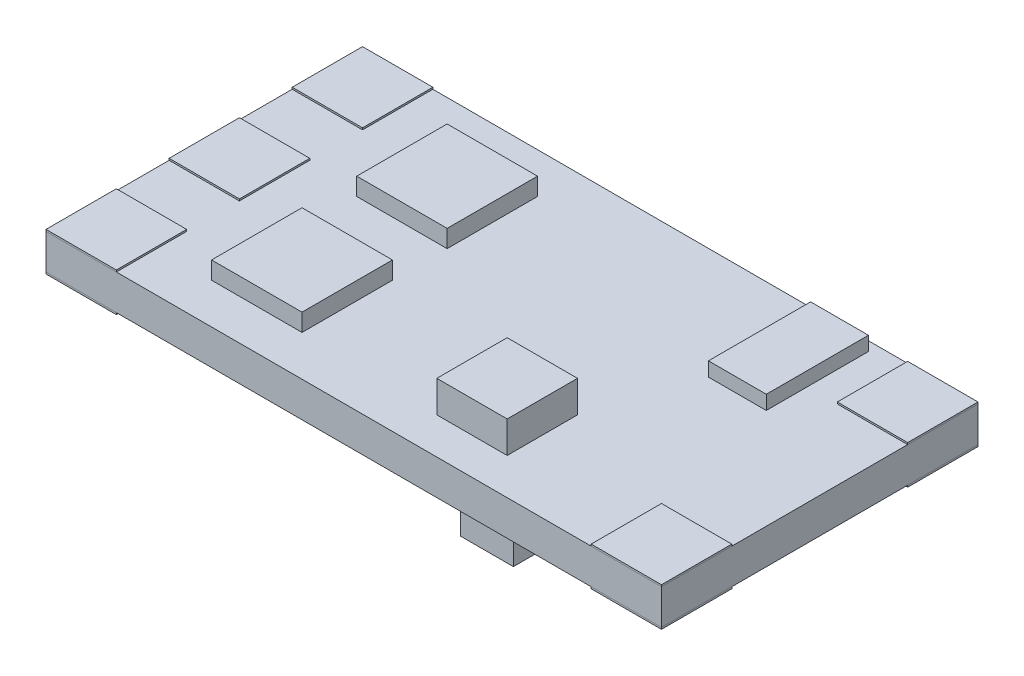
from build123d import *

# Parameters (mm, degrees)
SKETCH1_W             = 35
SKETCH1_H             = 18
BOSS_EXTRUDE1_DEPTH   = 2
SKETCH2_W             = 3.290634233
SKETCH2_H             = 5.810026068
BOSS_EXTRUDE2_DEPTH   = 0.8
SKETCH3_W             = 4
SKETCH3_H             = 4
BOSS_EXTRUDE3_DEPTH   = 1.8
SKETCH4_W             = 5.141615989
SKETCH4_H             = 5.141615989
BOSS_EXTRUDE4_DEPTH   = 1
BOSS_EXTRUDE4_2_DEPTH = 1
SKETCH5_W             = 4
SKETCH5_H             = 4
BOSS_EXTRUDE5_DEPTH   = 0.1
BOSS_EXTRUDE5_2_DEPTH = 0.1
BOSS_EXTRUDE5_3_DEPTH = 0.1
BOSS_EXTRUDE5_4_DEPTH = 0.1
BOSS_EXTRUDE5_5_DEPTH = 0.1
SKETCH6_W             = 6.694846846
SKETCH6_H             = 4.476078856
BOSS_EXTRUDE6_DEPTH   = 0.7
BOSS_EXTRUDE6_2_DEPTH = 0.7
BOSS_EXTRUDE6_3_DEPTH = 0.7
BOSS_EXTRUDE6_4_DEPTH = 0.7
BOSS_EXTRUDE6_5_DEPTH = 0.7
BOSS_EXTRUDE6_6_DEPTH = 0.7
SKETCH7_W             = 3
SKETCH7_H             = 1.6
BOSS_EXTRUDE7_DEPTH   = 1.8
BOSS_EXTRUDE7_2_DEPTH = 1.8
BOSS_EXTRUDE7_3_DEPTH = 1.8
BOSS_EXTRUDE7_4_DEPTH = 1.8
BOSS_EXTRUDE7_5_DEPTH = 1.8
BOSS_EXTRUDE7_6_DEPTH = 1.8
BOSS_EXTRUDE7_7_DEPTH = 1.8
BOSS_EXTRUDE7_8_DEPTH = 1.8


with BuildPart() as part:
    # Sketch1 → Boss-Extrude1 (new body)
    with BuildSketch(Plane(origin=(0, 0, 0), x_dir=(1, 0, 0), z_dir=(0, 1, 0))):
        Rectangle(SKETCH1_W, SKETCH1_H)
    extrude(amount=BOSS_EXTRUDE1_DEPTH)


with BuildPart() as body_2:
    # Sketch2 → Boss-Extrude2 (new body)
    with BuildSketch(Plane(origin=(0, 2, 0), x_dir=(1, 0, 0), z_dir=(0, 1, 0))):
        with Locations((10.154691578, 5.565799308)):
            Rectangle(SKETCH2_W, SKETCH2_H)
    extrude(amount=BOSS_EXTRUDE2_DEPTH)


with BuildPart() as body_3:
    # Sketch3 → Boss-Extrude3 (new body)
    with BuildSketch(Plane(origin=(0, 2, 0), x_dir=(1, 0, 0), z_dir=(0, 1, 0))):
        with Locations((4.647932234, -4.923097309)):
            Rectangle(SKETCH3_W, SKETCH3_H)
    extrude(amount=BOSS_EXTRUDE3_DEPTH)


with BuildPart() as body_4:
    # Sketch4 → Boss-Extrude4 (new body)
    with BuildSketch(Plane(origin=(0, 2, 0), x_dir=(1, 0, 0), z_dir=(0, 1, 0))):
        with Locations((-7.815256304, -4.126146832)):
            Rectangle(SKETCH4_W, SKETCH4_H)
    extrude(amount=BOSS_EXTRUDE4_DEPTH)


with BuildPart() as body_5:
    # Sketch4 → Boss-Extrude4 2 (new body)
    with BuildSketch(Plane(origin=(0, 2, 0), x_dir=(1, 0, 0), z_dir=(0, 1, 0))):
        with Locations((-7.815256304, 4.126146832)):
            Rectangle(SKETCH4_W, SKETCH4_H)
    extrude(amount=BOSS_EXTRUDE4_2_DEPTH)


with BuildPart() as body_6:
    # Sketch5 → Boss-Extrude5 (new body)
    with BuildSketch(Plane(origin=(0, 2, 0), x_dir=(1, 0, 0), z_dir=(0, 1, 0))):
        with Locations((-15.5, 7)):
            Rectangle(SKETCH5_W, SKETCH5_H)
    extrude(amount=BOSS_EXTRUDE5_DEPTH)


with BuildPart() as body_7:
    # Sketch5 → Boss-Extrude5 2 (new body)
    with BuildSketch(Plane(origin=(0, 2, 0), x_dir=(1, 0, 0), z_dir=(0, 1, 0))):
        with Locations((-15.5, 0)):
            Rectangle(SKETCH5_W, SKETCH5_H)
    extrude(amount=BOSS_EXTRUDE5_2_DEPTH)


with BuildPart() as body_8:
    # Sketch5 → Boss-Extrude5 3 (new body)
    with BuildSketch(Plane(origin=(0, 2, 0), x_dir=(1, 0, 0), z_dir=(0, 1, 0))):
        with Locations((15.5, -7)):
            Rectangle(SKETCH5_W, SKETCH5_H)
    extrude(amount=BOSS_EXTRUDE5_3_DEPTH)


with BuildPart() as body_9:
    # Sketch5 → Boss-Extrude5 4 (new body)
    with BuildSketch(Plane(origin=(0, 2, 0), x_dir=(1, 0, 0), z_dir=(0, 1, 0))):
        with Locations((-15.5, -7)):
            Rectangle(SKETCH5_W, SKETCH5_H)
    extrude(amount=BOSS_EXTRUDE5_4_DEPTH)


with BuildPart() as body_10:
    # Sketch5 → Boss-Extrude5 5 (new body)
    with BuildSketch(Plane(origin=(0, 2, 0), x_dir=(1, 0, 0), z_dir=(0, 1, 0))):
        with Locations((15.5, 7)):
            Rectangle(SKETCH5_W, SKETCH5_H)
    extrude(amount=BOSS_EXTRUDE5_5_DEPTH)


with BuildPart() as body_11:
    # Mirror1: mirrored copy
    add(body_6.part.mirror(Plane.ZX.offset(1)))


with BuildPart() as body_12:
    # Mirror1 2: mirrored copy
    add(body_7.part.mirror(Plane.ZX.offset(1)))


with BuildPart() as body_13:
    # Mirror1 3: mirrored copy
    add(body_9.part.mirror(Plane.ZX.offset(1)))


with BuildPart() as body_14:
    # Mirror1 4: mirrored copy
    add(body_10.part.mirror(Plane.ZX.offset(1)))


with BuildPart() as body_15:
    # Mirror1 5: mirrored copy
    add(body_8.part.mirror(Plane.ZX.offset(1)))


with BuildPart() as body_16:
    # Sketch6 → Boss-Extrude6 (new body)
    with BuildSketch(Plane.XZ):
        with Locations((-8.152576577, -6)):
            Rectangle(SKETCH6_W, SKETCH6_H)
    extrude(amount=BOSS_EXTRUDE6_DEPTH)


with BuildPart() as body_17:
    # Sketch6 → Boss-Extrude6 2 (new body)
    with BuildSketch(Plane.XZ):
        with Locations((-8.152576577, 6)):
            Rectangle(SKETCH6_W, SKETCH6_H)
    extrude(amount=BOSS_EXTRUDE6_2_DEPTH)


with BuildPart() as body_18:
    # Sketch6 → Boss-Extrude6 3 (new body)
    with BuildSketch(Plane.XZ):
        with Locations((-8.152576577, 0)):
            Rectangle(SKETCH6_W, SKETCH6_H)
    extrude(amount=BOSS_EXTRUDE6_3_DEPTH)


with BuildPart() as body_19:
    # Sketch6 → Boss-Extrude6 4 (new body)
    with BuildSketch(Plane.XZ):
        with Locations((0.152576577, -6)):
            Rectangle(SKETCH6_W, SKETCH6_H)
    extrude(amount=BOSS_EXTRUDE6_4_DEPTH)


with BuildPart() as body_20:
    # Sketch6 → Boss-Extrude6 5 (new body)
    with BuildSketch(Plane.XZ):
        with Locations((0.152576577, 0)):
            Rectangle(SKETCH6_W, SKETCH6_H)
    extrude(amount=BOSS_EXTRUDE6_5_DEPTH)


with BuildPart() as body_21:
    # Sketch6 → Boss-Extrude6 6 (new body)
    with BuildSketch(Plane.XZ):
        with Locations((0.152576577, 6)):
            Rectangle(SKETCH6_W, SKETCH6_H)
    extrude(amount=BOSS_EXTRUDE6_6_DEPTH)


with BuildPart() as body_22:
    # Sketch7 → Boss-Extrude7 (new body)
    with BuildSketch(Plane.XZ):
        with Locations((7, 5.444444444)):
            Rectangle(SKETCH7_W, SKETCH7_H)
    extrude(amount=BOSS_EXTRUDE7_DEPTH)


with BuildPart() as body_23:
    # Sketch7 → Boss-Extrude7 2 (new body)
    with BuildSketch(Plane.XZ):
        with Locations((7, 7.622222222)):
            Rectangle(SKETCH7_W, SKETCH7_H)
    extrude(amount=BOSS_EXTRUDE7_2_DEPTH)


with BuildPart() as body_24:
    # Sketch7 → Boss-Extrude7 3 (new body)
    with BuildSketch(Plane.XZ):
        with Locations((7, 3.266666667)):
            Rectangle(SKETCH7_W, SKETCH7_H)
    extrude(amount=BOSS_EXTRUDE7_3_DEPTH)


with BuildPart() as body_25:
    # Sketch7 → Boss-Extrude7 4 (new body)
    with BuildSketch(Plane.XZ):
        with Locations((7, 1.088888889)):
            Rectangle(SKETCH7_W, SKETCH7_H)
    extrude(amount=BOSS_EXTRUDE7_4_DEPTH)


with BuildPart() as body_26:
    # Sketch7 → Boss-Extrude7 5 (new body)
    with BuildSketch(Plane.XZ):
        with Locations((7, -1.088888889)):
            Rectangle(SKETCH7_W, SKETCH7_H)
    extrude(amount=BOSS_EXTRUDE7_5_DEPTH)


with BuildPart() as body_27:
    # Sketch7 → Boss-Extrude7 6 (new body)
    with BuildSketch(Plane.XZ):
        with Locations((7, -3.266666667)):
            Rectangle(SKETCH7_W, SKETCH7_H)
    extrude(amount=BOSS_EXTRUDE7_6_DEPTH)


with BuildPart() as body_28:
    # Sketch7 → Boss-Extrude7 7 (new body)
    with BuildSketch(Plane.XZ):
        with Locations((7, -5.444444444)):
            Rectangle(SKETCH7_W, SKETCH7_H)
    extrude(amount=BOSS_EXTRUDE7_7_DEPTH)


with BuildPart() as body_29:
    # Sketch7 → Boss-Extrude7 8 (new body)
    with BuildSketch(Plane.XZ):
        with Locations((7, -7.622222222)):
            Rectangle(SKETCH7_W, SKETCH7_H)
    extrude(amount=BOSS_EXTRUDE7_8_DEPTH)


solid = Compound([part.part, body_2.part, body_3.part, body_4.part, body_5.part, body_6.part, body_7.part, body_8.part, body_9.part, body_10.part, body_11.part, body_12.part, body_13.part, body_14.part, body_15.part, body_16.part, body_17.part, body_18.part, body_19.part, body_20.part, body_21.part, body_22.part, body_23.part, body_24.part, body_25.part, body_26.part, body_27.part, body_28.part, body_29.part])
